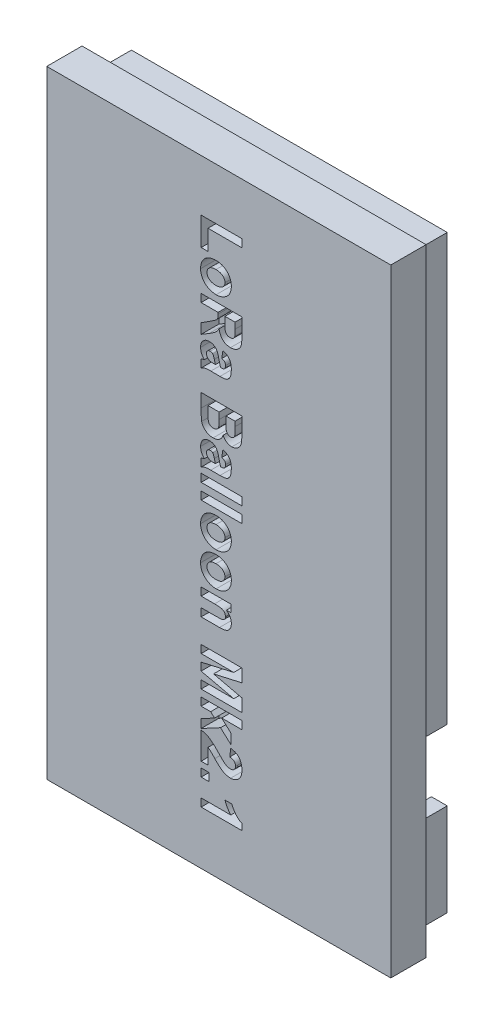
from build123d import *

# Parameters (mm, degrees)
SKETCH1_W          = 39
SKETCH1_H          = 70
BASE_DEPTH         = 4
SKETCH2_W          = 35.8
SKETCH2_H          = 66.8
SKETCH2_W_2        = 32.2
SKETCH2_H_2        = 63.2
MOUNT_DEPTH        = 4
SKETCH3_W          = 0.900579279
SKETCH3_H          = 0.90057928
SKETCH3_W_2        = 4.622973633
SKETCH3_H_2        = 0.900579279
NAME_DEPTH         = 2
SKETCH4_W          = 4
SKETCH4_H          = 8
CUT_EXTRUDE1_DEPTH = 1.8
SKETCH5_W          = 10
SKETCH5_H          = 4
CUT_EXTRUDE2_DEPTH = 1.8


with BuildPart() as part:
    # Sketch1 → Base (new body)
    with BuildSketch(Plane.XY):
        with Locations((19.5, 35)):
            Rectangle(SKETCH1_W, SKETCH1_H)
    extrude(amount=BASE_DEPTH)

    # Sketch2 → Mount (add)
    with BuildSketch(Plane(origin=(0, 0, 0), x_dir=(-1, 0, 0), z_dir=(0, 0, -1))):
        with Locations((-19.5, 35)):
            Rectangle(SKETCH2_W, SKETCH2_H)
        with Locations((-19.5, 35)):
            Rectangle(SKETCH2_W_2, SKETCH2_H_2, mode=Mode.SUBTRACT)
    extrude(amount=MOUNT_DEPTH)

    # Sketch3 → Name (cut)
    # profile 1 of 16: a face of its own
    with BuildSketch(Plane.XY.offset(4)):
        with BuildLine():
            Line((17.5, 6.031366522), (17.5, 6.931945801))
            Line((17.5, 6.931945801), (20.862162642, 6.931945801))
            add(Edge.make_bspline(
                [(20.862162642, 6.931945801), (20.825420678, 6.973453861), (20.752187332, 7.056186897), (20.650809234, 7.187206769), (20.557100635, 7.322777322), (20.471558908, 7.463891787), (20.391697133, 7.608335094), (20.320234004, 7.758471363), (20.256125646, 7.91310561), (20.219928142, 8.019309163), (20.201737837, 8.072679554)],
                knots=[0, 0, 0, 0, 1.001509735, 1.996189151, 2.991510399, 3.978083136, 4.977007007, 5.972841423, 6.981293538, 8, 8, 8, 8], degree=3))
            Line((20.201737837, 8.072679554), (20.982239879, 8.072679554))
            add(Edge.make_bspline(
                [(20.982239879, 8.072679554), (21.005109125, 8.009636198), (21.052173734, 7.879893794), (21.148968325, 7.688624219), (21.269130809, 7.494509439), (21.384880743, 7.332887129), (21.488031291, 7.207004744), (21.569425456, 7.118590303), (21.654643351, 7.038363577), (21.742171402, 6.965389753), (21.83321772, 6.900070199), (21.926439738, 6.842109696), (22.022864157, 6.791460098), (22.089583646, 6.764422764), (22.122973633, 6.750891842)],
                knots=[0, 0, 0, 0, 1.342167567, 2.762163326, 4.283089962, 5.911699164, 6.739232247, 7.541374442, 8.316663201, 9.081638931, 9.82204544, 10.55892081, 11.278807199, 12, 12, 12, 12], degree=3))
            Line((22.122973633, 6.750891842), (22.122973633, 6.031366522))
            Line((22.122973633, 6.031366522), (17.5, 6.031366522))
        make_face()
    # profile 2 of 16: a face of its own
    with BuildSketch(Plane.XY.offset(4)):
        with Locations((17.950289639, 9.423548473)):
            Rectangle(SKETCH3_W, SKETCH3_H)
    # profile 3 of 16: a face of its own
    with BuildSketch(Plane.XY.offset(4)):
        with BuildLine():
            Line((18.280502042, 10.534262917), (17.5, 10.534262917))
            Line((17.5, 10.534262917), (17.5, 13.596232466))
            add(Edge.make_bspline(
                [(17.5, 13.596232466), (17.576949108, 13.585805601), (17.731103203, 13.564917198), (17.956960174, 13.50144426), (18.176976559, 13.413558777), (18.355748105, 13.319061126), (18.500491615, 13.226498924), (18.618013159, 13.142016572), (18.743992969, 13.043312165), (18.877122245, 12.928814113), (19.01967577, 12.800831624), (19.169263399, 12.656658807), (19.328268107, 12.499154665), (19.435248568, 12.387579437), (19.490655448, 12.329792855)],
                knots=[0, 0, 0, 0, 1.156489976, 2.316825642, 3.486320793, 4.683282346, 5.324698959, 6.046521303, 6.840115785, 7.709802379, 8.663715879, 9.695716306, 10.80657488, 12, 12, 12, 12], degree=3))
            add(Edge.make_bspline(
                [(19.490655448, 12.329792855), (19.534031724, 12.284677519), (19.616947467, 12.198437484), (19.736659107, 12.076728308), (19.8457136, 11.968753812), (19.942980669, 11.874007239), (20.029091873, 11.792707575), (20.105351076, 11.726417986), (20.169302387, 11.672159687), (20.210020272, 11.642893937), (20.228004733, 11.629967707)],
                knots=[0, 0, 0, 0, 1.475912402, 2.821274315, 4.025817635, 5.094889091, 6.023583783, 6.817889709, 7.477880126, 8, 8, 8, 8], degree=3))
            add(Edge.make_bspline(
                [(20.228004733, 11.629967707), (20.273808559, 11.600082147), (20.362500689, 11.542213313), (20.505070734, 11.481150256), (20.648064319, 11.442092349), (20.744350233, 11.437235769), (20.791804886, 11.434842196)],
                knots=[0, 0, 0, 0, 1.081757693, 2.094658972, 3.060949906, 4, 4, 4, 4], degree=3))
            add(Edge.make_bspline(
                [(20.791804886, 11.434842196), (20.839190464, 11.436345215), (20.929033186, 11.439194926), (21.054547391, 11.468228017), (21.162042796, 11.516383402), (21.250119658, 11.584209246), (21.318369668, 11.668283776), (21.367895285, 11.764693051), (21.397955403, 11.87335497), (21.400954099, 11.949662912), (21.40251021, 11.989261315)],
                knots=[0, 0, 0, 0, 1.215311032, 2.304221153, 3.285231831, 4.218502273, 5.131618139, 6.043921387, 6.984934089, 8, 8, 8, 8], degree=3))
            add(Edge.make_bspline(
                [(21.40251021, 11.989261315), (21.400764871, 12.032313466), (21.397439101, 12.11434999), (21.365944968, 12.229621644), (21.313665414, 12.329258262), (21.238787013, 12.412038323), (21.143533218, 12.478619319), (21.0275452, 12.527929185), (20.89161993, 12.561367794), (20.793877377, 12.57065489), (20.742085405, 12.57557595)],
                knots=[0, 0, 0, 0, 1.036204622, 1.974503585, 2.854824847, 3.725113167, 4.639232692, 5.635159131, 6.746914543, 8, 8, 8, 8], degree=3))
            Line((20.742085405, 12.57557595), (20.862162642, 13.476155229))
            add(Edge.make_bspline(
                [(20.862162642, 13.476155229), (20.914856848, 13.468924903), (21.017247203, 13.454875622), (21.164229292, 13.419446686), (21.300577042, 13.375788336), (21.426342918, 13.322550059), (21.540554019, 13.258218808), (21.644379225, 13.184749982), (21.738273215, 13.102054447), (21.819847944, 13.008347774), (21.891505772, 12.906292566), (21.953692359, 12.79596872), (22.0057178, 12.677623463), (22.049852168, 12.551778027), (22.081514616, 12.417328436), (22.106536559, 12.275228717), (22.120320981, 12.12493433), (22.122076294, 12.022120737), (22.122973633, 11.969561143)],
                knots=[0, 0, 0, 0, 1.162602182, 2.259057697, 3.301481224, 4.291058719, 5.240278367, 6.162482201, 7.068337645, 7.969664106, 8.872804886, 9.791477257, 10.734443434, 11.696874505, 12.703694303, 13.751554906, 14.850566762, 16, 16, 16, 16], degree=3))
            add(Edge.make_bspline(
                [(22.122973633, 11.969561143), (22.12216436, 11.911958212), (22.120593899, 11.80017506), (22.10070975, 11.638117668), (22.072004647, 11.486359857), (22.028214484, 11.346159334), (21.974171699, 11.215978856), (21.906051478, 11.097706108), (21.827160263, 10.989068519), (21.734640289, 10.894424656), (21.635492304, 10.810293791), (21.531834654, 10.737169245), (21.425852143, 10.673343767), (21.315019184, 10.622432795), (21.20055895, 10.583091186), (21.082762706, 10.554948562), (20.961508115, 10.537346514), (20.879421508, 10.535300855), (20.837771953, 10.534262917)],
                knots=[0, 0, 0, 0, 1.276022515, 2.476225004, 3.613980213, 4.694828494, 5.72599757, 6.731860776, 7.713356894, 8.693775576, 9.657589192, 10.592250898, 11.502803356, 12.395963178, 13.290278707, 14.181284388, 15.077210041, 16, 16, 16, 16], degree=3))
            add(Edge.make_bspline(
                [(20.837771953, 10.534262917), (20.790493163, 10.535236326), (20.696531434, 10.537170874), (20.556651025, 10.556121701), (20.418916098, 10.584936664), (20.282434953, 10.625329041), (20.14772348, 10.679930058), (20.012250121, 10.745399086), (19.877267542, 10.824863433), (19.764667283, 10.900724227), (19.671792871, 10.969915424), (19.596838962, 11.030770989), (19.518336525, 11.10098997), (19.433551797, 11.177527932), (19.344911187, 11.263130781), (19.250792263, 11.356025715), (19.152318029, 11.457407218), (19.085896671, 11.528535938), (19.05162305, 11.565238571)],
                knots=[0, 0, 0, 0, 1.065579015, 2.117728587, 3.177060151, 4.236743671, 5.322224058, 6.451217098, 7.626726301, 8.850986631, 9.510985169, 10.237811417, 11.027173618, 11.885690493, 12.813298488, 13.805522413, 14.867642961, 16, 16, 16, 16], degree=3))
            add(Edge.make_bspline(
                [(19.05162305, 11.565238571), (19.020079063, 11.599046391), (18.960015664, 11.663420389), (18.873550311, 11.754882826), (18.794668334, 11.835818348), (18.72567576, 11.908457691), (18.664320168, 11.970319157), (18.611893835, 12.023282507), (18.567294086, 12.065946194), (18.500825624, 12.127365663), (18.409279651, 12.203320651), (18.322081773, 12.25719707), (18.280502042, 12.282887684)],
                knots=[0, 0, 0, 0, 1.312344043, 2.498854831, 3.572154266, 4.519962786, 5.342095471, 6.044967059, 6.635010651, 7.093519002, 8.614063769, 10, 10, 10, 10], degree=3))
            Line((18.280502042, 12.282887684), (18.280502042, 10.534262917))
        make_face()
    # profile 4 of 16: a face of its own
    with BuildSketch(Plane.XY.offset(4)):
        Polygon((17.5, 16.838317871), (22.122973633, 16.838317871), (22.122973633, 15.937738592), (19.829310781, 15.937738592), (20.862162642, 14.999635176), (20.862162642, 13.86640625), (19.697976303, 14.922710696), (17.5, 13.746329013), (17.5, 14.715389841), (19.026294257, 15.532477916), (18.580695135, 15.937738592), (17.5, 15.937738592), align=None)
    # profile 5 of 16: a face of its own
    with BuildSketch(Plane.XY.offset(4)):
        Polygon((17.5, 22.001639071), (22.122973633, 22.001639071), (22.122973633, 20.538197743), (18.90903133, 19.810229492), (22.122973633, 19.06537538), (22.122973633, 17.618819913), (17.5, 17.618819913), (17.5, 18.519399192), (21.198941768, 18.519399192), (17.5, 19.378701921), (17.5, 20.261457235), (21.198941768, 21.101059792), (17.5, 21.101059792), align=None)
    # profile 6 of 16: a face of its own
    with BuildSketch(Plane.XY.offset(4)):
        with BuildLine():
            Line((17.5, 24.703376909), (17.5, 25.603956188))
            Line((17.5, 25.603956188), (19.218605458, 25.603956188))
            add(Edge.make_bspline(
                [(19.218605458, 25.603956188), (19.259881981, 25.604218431), (19.33868675, 25.604719103), (19.451598313, 25.606227025), (19.553850951, 25.610184029), (19.645484529, 25.614787512), (19.726240729, 25.620031047), (19.796064397, 25.627355164), (19.8548999, 25.636629558), (19.918206403, 25.649836461), (19.986420727, 25.672573643), (20.058026651, 25.710356309), (20.120869879, 25.756588033), (20.171139913, 25.813649771), (20.211805696, 25.876565918), (20.241236399, 25.944645495), (20.258624837, 26.017106197), (20.26071657, 26.066660636), (20.261776456, 26.091769964)],
                knots=[0, 0, 0, 0, 1.518468101, 2.899045743, 4.15374029, 5.282521764, 6.274203078, 7.130400985, 7.864176346, 8.464331223, 9.50833919, 10.496277288, 11.432641907, 12.361201578, 13.276990523, 14.178728215, 15.077158116, 16, 16, 16, 16], degree=3))
            add(Edge.make_bspline(
                [(20.261776456, 26.091769964), (20.260395831, 26.124432779), (20.257666872, 26.188994447), (20.234037383, 26.282658539), (20.197101841, 26.371978971), (20.144264328, 26.45430824), (20.080370598, 26.530343486), (20.001643315, 26.592223164), (19.913268019, 26.643887595), (19.829602888, 26.676153618), (19.752735925, 26.695237438), (19.683087132, 26.709741518), (19.601504403, 26.72009486), (19.508648449, 26.729871123), (19.404062142, 26.735525227), (19.288092488, 26.741809576), (19.160451233, 26.744093369), (19.071635516, 26.744485574), (19.025356154, 26.744689941)],
                knots=[0, 0, 0, 0, 0.987208667, 1.951327175, 2.905781144, 3.900987558, 4.900863378, 5.897104334, 6.91491578, 7.990576578, 8.596595857, 9.311207409, 10.142408639, 11.084155198, 12.136793968, 13.311756484, 14.59923223, 16, 16, 16, 16], degree=3))
            Line((19.025356154, 26.744689941), (17.5, 26.744689941))
            Line((17.5, 26.744689941), (17.5, 27.645269221))
            Line((17.5, 27.645269221), (20.862162642, 27.645269221))
            Line((20.862162642, 27.645269221), (20.862162642, 26.80472856))
            Line((20.862162642, 26.80472856), (20.369658349, 26.80472856))
            add(Edge.make_bspline(
                [(20.369658349, 26.80472856), (20.413616533, 26.770321373), (20.49957413, 26.703040178), (20.611985052, 26.588858325), (20.708270507, 26.468850505), (20.786728659, 26.341680594), (20.847225588, 26.20722185), (20.890517621, 26.066086122), (20.917784325, 25.918022166), (20.920714558, 25.816711582), (20.922201261, 25.765309975)],
                knots=[0, 0, 0, 0, 1.093461536, 2.13819855, 3.132977593, 4.104514142, 5.059389303, 6.015385568, 6.993072912, 8, 8, 8, 8], degree=3))
            add(Edge.make_bspline(
                [(20.922201261, 25.765309975), (20.920317919, 25.706700332), (20.91666388, 25.59298654), (20.885696808, 25.429335393), (20.832707603, 25.280159734), (20.760298213, 25.146629132), (20.672194055, 25.030041421), (20.570901367, 24.931660785), (20.456656392, 24.854076223), (20.352110831, 24.804673832), (20.260861224, 24.775259714), (20.185114665, 24.755547549), (20.101698698, 24.739757931), (20.011142966, 24.727221383), (19.913646699, 24.715475495), (19.808775892, 24.70812277), (19.696745732, 24.704905258), (19.619489692, 24.703895822), (19.579775273, 24.703376909)],
                knots=[0, 0, 0, 0, 1.428465185, 2.77149258, 4.042602701, 5.274402086, 6.460971935, 7.593531473, 8.701853732, 9.81394723, 10.399934156, 11.038034574, 11.721500487, 12.468854998, 13.267186475, 14.115831328, 15.031419898, 16, 16, 16, 16], degree=3))
            Line((19.579775273, 24.703376909), (17.5, 24.703376909))
        make_face()
    # profile 7 of 16: a face of its own
    with BuildSketch(Plane.XY.offset(4)):
        with BuildLine():
            add(Edge.make_bspline(
                [(19.227986492, 31.667856667), (19.268340591, 31.667036399), (19.348241235, 31.665412278), (19.466831788, 31.655463322), (19.582597294, 31.63605464), (19.695714536, 31.61096501), (19.806416527, 31.579441893), (19.913363069, 31.538151235), (20.018572563, 31.492044265), (20.119538873, 31.437034064), (20.216642118, 31.37772074), (20.307982668, 31.31296281), (20.392270804, 31.242988622), (20.471764649, 31.17048616), (20.542963196, 31.091302442), (20.610173753, 31.009624992), (20.668761487, 30.921545212), (20.722741328, 30.830764248), (20.769340893, 30.735441575), (20.810963092, 30.637695358), (20.84421655, 30.535984358), (20.874003462, 30.432726526), (20.895076066, 30.325606876), (20.911226693, 30.216077493), (20.920807626, 30.103272259), (20.921733394, 30.027131659), (20.922201261, 29.988651553)],
                knots=[0, 0, 0, 0, 1.087797627, 2.153826546, 3.204146119, 4.249074796, 5.276002369, 6.302929943, 7.33671768, 8.369955531, 9.399197913, 10.402506754, 11.384561342, 12.350717656, 13.299250364, 14.252266119, 15.199037181, 16.147307724, 17.097187567, 18.056740571, 19.008264324, 19.97962709, 20.951574749, 21.948063114, 22.962987564, 24, 24, 24, 24], degree=3))
            add(Edge.make_bspline(
                [(20.922201261, 29.988651553), (20.920492435, 29.924793493), (20.917163302, 29.800385279), (20.89380331, 29.618918473), (20.853287611, 29.448294563), (20.797267351, 29.287458199), (20.72326136, 29.137817172), (20.634810544, 28.997501786), (20.529143938, 28.868450261), (20.40795289, 28.752300781), (20.277240101, 28.647523356), (20.139130934, 28.556579151), (19.996080966, 28.47910388), (19.847473094, 28.415937377), (19.693540221, 28.365560189), (19.533372162, 28.331856616), (19.368435672, 28.308776132), (19.256523789, 28.306730224), (19.199843389, 28.305694025)],
                knots=[0, 0, 0, 0, 1.136040707, 2.213233445, 3.248238065, 4.25119704, 5.236487175, 6.211911138, 7.196384178, 8.195725979, 9.1931767, 10.173001403, 11.133846892, 12.083513917, 13.042376269, 14.010298635, 14.992269034, 16, 16, 16, 16], degree=3))
            add(Edge.make_bspline(
                [(19.199843389, 28.305694025), (19.157599655, 28.306375339), (19.0738988, 28.307725281), (18.949923499, 28.319708358), (18.828866965, 28.336918185), (18.710806659, 28.362715812), (18.595913097, 28.394995558), (18.484212787, 28.436018323), (18.375843769, 28.483701954), (18.270645012, 28.537857586), (18.171228883, 28.598868058), (18.076479739, 28.663312491), (17.989613644, 28.733981019), (17.908343846, 28.808413365), (17.833120613, 28.887136475), (17.764474284, 28.970880003), (17.702322369, 29.059272896), (17.647348245, 29.152054033), (17.598380596, 29.247901658), (17.556075444, 29.34662638), (17.52061437, 29.447625363), (17.49154767, 29.55076545), (17.4673821, 29.655801901), (17.452433072, 29.763820298), (17.441007522, 29.873647075), (17.440311587, 29.947656406), (17.439961381, 29.984899139)],
                knots=[0, 0, 0, 0, 1.117558833, 2.214307803, 3.293244786, 4.351421184, 5.409597582, 6.448807362, 7.497331125, 8.540978692, 9.576922014, 10.582241184, 11.570837346, 12.537122916, 13.496974449, 14.449450387, 15.399839374, 16.353464778, 17.300823134, 18.246083241, 19.193441597, 20.131138339, 21.080698472, 22.042616426, 23.015011865, 24, 24, 24, 24], degree=3))
            add(Edge.make_bspline(
                [(17.439961381, 29.984899139), (17.441434818, 30.04406421), (17.444329398, 30.160294537), (17.466190044, 30.33088657), (17.502637169, 30.493596014), (17.553836141, 30.648679353), (17.618260134, 30.796499008), (17.698440035, 30.936217507), (17.79447105, 31.067058897), (17.902499007, 31.190733435), (18.024251963, 31.303867806), (18.159878703, 31.401567068), (18.308067385, 31.483794972), (18.468125433, 31.551399101), (18.640780217, 31.603847691), (18.825794291, 31.641044136), (19.022910429, 31.66380433), (19.158504181, 31.666483685), (19.227986492, 31.667856667)],
                knots=[0, 0, 0, 0, 1.024594995, 2.012826322, 2.973358778, 3.908543225, 4.837401023, 5.761810751, 6.69243552, 7.644223827, 8.602462928, 9.564551743, 10.532007457, 11.531954493, 12.568505162, 13.651979317, 14.796803673, 16, 16, 16, 16], degree=3))
        make_face()
        with BuildLine():
            add(Edge.make_bspline(
                [(19.181081321, 30.767277388), (19.140418132, 30.7664685), (19.061457429, 30.764897782), (18.946509384, 30.755317355), (18.839622498, 30.735604285), (18.739486697, 30.712662461), (18.647961982, 30.678719777), (18.563118232, 30.640144076), (18.486368037, 30.592693862), (18.418159022, 30.538377324), (18.358227437, 30.478913691), (18.305063926, 30.416760149), (18.260023454, 30.351559232), (18.223835025, 30.282773737), (18.195763008, 30.211300883), (18.174765469, 30.136603171), (18.162389452, 30.058800558), (18.161082475, 30.005893388), (18.160424805, 29.979270519)],
                knots=[0, 0, 0, 0, 1.347985487, 2.617548842, 3.817114289, 4.948286482, 6.017057593, 7.046407217, 8.032969353, 8.999289909, 9.930051738, 10.827140183, 11.706817169, 12.550594062, 13.397420762, 14.247349517, 15.118066881, 16, 16, 16, 16], degree=3))
            add(Edge.make_bspline(
                [(18.160424805, 29.979270519), (18.161082172, 29.95327184), (18.162388524, 29.90160605), (18.174768649, 29.825667547), (18.195758212, 29.752830162), (18.224167513, 29.682614172), (18.260561859, 29.61498155), (18.306359128, 29.551083491), (18.359147439, 29.489568475), (18.42010437, 29.431777283), (18.488357165, 29.377647138), (18.565874129, 29.331881148), (18.650982245, 29.2934674), (18.743354127, 29.261692013), (18.843361939, 29.236148079), (18.951359004, 29.218739084), (19.067059726, 29.208514906), (19.146662829, 29.207035174), (19.187648045, 29.206273304)],
                knots=[0, 0, 0, 0, 0.86498205, 1.718932724, 2.552529207, 3.383717481, 4.236080589, 5.102502034, 5.995588818, 6.930639414, 7.894730959, 8.889086482, 9.918564038, 10.998334367, 12.1369617, 13.350269694, 14.635734454, 16, 16, 16, 16], degree=3))
            add(Edge.make_bspline(
                [(19.187648045, 29.206273304), (19.227688932, 29.207071515), (19.305407142, 29.208620818), (19.418448526, 29.21833585), (19.523973479, 29.237633658), (19.622320571, 29.262397561), (19.713524667, 29.294467861), (19.797316766, 29.333759882), (19.873991238, 29.380754838), (19.942107737, 29.435517195), (20.003044034, 29.494278407), (20.055828048, 29.556726541), (20.101619145, 29.621572383), (20.138009283, 29.690136473), (20.166408615, 29.761288764), (20.187393837, 29.83506114), (20.199774112, 29.911930299), (20.201080471, 29.964216902), (20.201737837, 29.99052776)],
                knots=[0, 0, 0, 0, 1.337232047, 2.595528913, 3.783536199, 4.915617704, 5.97906533, 7.006690339, 8.000659516, 8.974235141, 9.919454987, 10.823278711, 11.700968276, 12.565199868, 13.408680491, 14.254935835, 15.121875735, 16, 16, 16, 16], degree=3))
            add(Edge.make_bspline(
                [(20.201737837, 29.99052776), (20.201125638, 30.01684595), (20.199923414, 30.068529121), (20.187117275, 30.14469067), (20.1666105, 30.217653188), (20.137959369, 30.288106282), (20.10165055, 30.355793068), (20.055496899, 30.419705203), (20.003354012, 30.482079465), (19.942036507, 30.539894934), (19.873587127, 30.593986498), (19.796542842, 30.640468461), (19.712370979, 30.68027929), (19.620397249, 30.711967226), (19.521262796, 30.737162293), (19.414268616, 30.754931366), (19.300102491, 30.764983319), (19.221439565, 30.766499505), (19.181081321, 30.767277388)],
                knots=[0, 0, 0, 0, 0.8777483, 1.723705717, 2.56959874, 3.403036217, 4.257705828, 5.126471818, 6.029908573, 6.967489424, 7.934189811, 8.936630112, 9.963815147, 11.036651848, 12.178360317, 13.374360467, 14.652907978, 16, 16, 16, 16], degree=3))
        make_face(mode=Mode.SUBTRACT)
    # profile 8 of 16: a face of its own
    with BuildSketch(Plane.XY.offset(4)):
        with BuildLine():
            add(Edge.make_bspline(
                [(19.227986492, 35.510328258), (19.268340591, 35.50950799), (19.348241235, 35.507883869), (19.466831788, 35.497934913), (19.582597294, 35.478526231), (19.695714536, 35.453436601), (19.806416527, 35.421913484), (19.913363069, 35.380622826), (20.018572563, 35.334515856), (20.119538873, 35.279505655), (20.216642118, 35.22019233), (20.307982668, 35.155434401), (20.392270804, 35.085460213), (20.471764649, 35.012957751), (20.542963196, 34.933774033), (20.610173753, 34.852096583), (20.668761487, 34.764016803), (20.722741328, 34.673235839), (20.769340893, 34.577913166), (20.810963092, 34.480166949), (20.84421655, 34.378455949), (20.874003462, 34.275198117), (20.895076066, 34.168078467), (20.911226693, 34.058549084), (20.920807626, 33.945743849), (20.921733394, 33.86960325), (20.922201261, 33.831123144)],
                knots=[0, 0, 0, 0, 1.087797627, 2.153826546, 3.204146119, 4.249074796, 5.276002369, 6.302929943, 7.33671768, 8.369955531, 9.399197913, 10.402506754, 11.384561342, 12.350717656, 13.299250364, 14.252266119, 15.199037181, 16.147307724, 17.097187567, 18.056740571, 19.008264324, 19.97962709, 20.951574749, 21.948063114, 22.962987564, 24, 24, 24, 24], degree=3))
            add(Edge.make_bspline(
                [(20.922201261, 33.831123144), (20.920492435, 33.767265084), (20.917163302, 33.64285687), (20.89380331, 33.461390064), (20.853287611, 33.290766154), (20.797267351, 33.12992979), (20.72326136, 32.980288763), (20.634810544, 32.839973377), (20.529143938, 32.710921852), (20.40795289, 32.594772372), (20.277240101, 32.489994947), (20.139130934, 32.399050742), (19.996080966, 32.321575471), (19.847473094, 32.258408968), (19.693540221, 32.20803178), (19.533372162, 32.174328206), (19.368435672, 32.151247723), (19.256523789, 32.149201815), (19.199843389, 32.148165616)],
                knots=[0, 0, 0, 0, 1.136040707, 2.213233445, 3.248238065, 4.25119704, 5.236487175, 6.211911138, 7.196384178, 8.195725979, 9.1931767, 10.173001403, 11.133846892, 12.083513917, 13.042376269, 14.010298635, 14.992269034, 16, 16, 16, 16], degree=3))
            add(Edge.make_bspline(
                [(19.199843389, 32.148165616), (19.157599655, 32.14884693), (19.0738988, 32.150196872), (18.949923499, 32.162179949), (18.828866965, 32.179389776), (18.710806659, 32.205187403), (18.595913097, 32.237467149), (18.484212787, 32.278489913), (18.375843769, 32.326173545), (18.270645012, 32.380329177), (18.171228883, 32.441339649), (18.076479739, 32.505784082), (17.989613644, 32.57645261), (17.908343846, 32.650884955), (17.833120613, 32.729608066), (17.764474284, 32.813351594), (17.702322369, 32.901744487), (17.647348245, 32.994525624), (17.598380596, 33.090373249), (17.556075444, 33.189097971), (17.52061437, 33.290096954), (17.49154767, 33.393237041), (17.4673821, 33.498273492), (17.452433072, 33.606291889), (17.441007522, 33.716118666), (17.440311587, 33.790127997), (17.439961381, 33.82737073)],
                knots=[0, 0, 0, 0, 1.117558833, 2.214307803, 3.293244786, 4.351421184, 5.409597582, 6.448807362, 7.497331125, 8.540978692, 9.576922014, 10.582241184, 11.570837346, 12.537122916, 13.496974449, 14.449450387, 15.399839374, 16.353464778, 17.300823134, 18.246083241, 19.193441597, 20.131138339, 21.080698472, 22.042616426, 23.015011865, 24, 24, 24, 24], degree=3))
            add(Edge.make_bspline(
                [(17.439961381, 33.82737073), (17.441434818, 33.886535801), (17.444329398, 34.002766128), (17.466190044, 34.173358161), (17.502637169, 34.336067605), (17.553836141, 34.491150944), (17.618260134, 34.638970598), (17.698440035, 34.778689098), (17.79447105, 34.909530488), (17.902499007, 35.033205026), (18.024251963, 35.146339397), (18.159878703, 35.244038659), (18.308067385, 35.326266563), (18.468125433, 35.393870691), (18.640780217, 35.446319282), (18.825794291, 35.483515727), (19.022910429, 35.506275921), (19.158504181, 35.508955276), (19.227986492, 35.510328258)],
                knots=[0, 0, 0, 0, 1.024594995, 2.012826322, 2.973358778, 3.908543225, 4.837401023, 5.761810751, 6.69243552, 7.644223827, 8.602462928, 9.564551743, 10.532007457, 11.531954493, 12.568505162, 13.651979317, 14.796803673, 16, 16, 16, 16], degree=3))
        make_face()
        with BuildLine():
            add(Edge.make_bspline(
                [(19.181081321, 34.609748979), (19.140418132, 34.608940091), (19.061457429, 34.607369372), (18.946509384, 34.597788946), (18.839622498, 34.578075876), (18.739486697, 34.555134052), (18.647961982, 34.521191368), (18.563118232, 34.482615667), (18.486368037, 34.435165452), (18.418159022, 34.380848915), (18.358227437, 34.321385282), (18.305063926, 34.25923174), (18.260023454, 34.194030823), (18.223835025, 34.125245328), (18.195763008, 34.053772474), (18.174765469, 33.979074761), (18.162389452, 33.901272149), (18.161082475, 33.848364979), (18.160424805, 33.82174211)],
                knots=[0, 0, 0, 0, 1.347985487, 2.617548842, 3.817114289, 4.948286482, 6.017057593, 7.046407217, 8.032969353, 8.999289909, 9.930051738, 10.827140183, 11.706817169, 12.550594062, 13.397420762, 14.247349517, 15.118066881, 16, 16, 16, 16], degree=3))
            add(Edge.make_bspline(
                [(18.160424805, 33.82174211), (18.161082172, 33.795743431), (18.162388524, 33.744077641), (18.174768649, 33.668139138), (18.195758212, 33.595301753), (18.224167513, 33.525085763), (18.260561859, 33.457453141), (18.306359128, 33.393555082), (18.359147439, 33.332040066), (18.42010437, 33.274248873), (18.488357165, 33.220118729), (18.565874129, 33.174352739), (18.650982245, 33.135938991), (18.743354127, 33.104163604), (18.843361939, 33.07861967), (18.951359004, 33.061210674), (19.067059726, 33.050986497), (19.146662829, 33.049506765), (19.187648045, 33.048744895)],
                knots=[0, 0, 0, 0, 0.86498205, 1.718932724, 2.552529207, 3.383717481, 4.236080589, 5.102502034, 5.995588818, 6.930639414, 7.894730959, 8.889086482, 9.918564038, 10.998334367, 12.1369617, 13.350269694, 14.635734454, 16, 16, 16, 16], degree=3))
            add(Edge.make_bspline(
                [(19.187648045, 33.048744895), (19.227688932, 33.049543106), (19.305407142, 33.051092409), (19.418448526, 33.060807441), (19.523973479, 33.080105249), (19.622320571, 33.104869152), (19.713524667, 33.136939452), (19.797316766, 33.176231473), (19.873991238, 33.223226429), (19.942107737, 33.277988786), (20.003044034, 33.336749998), (20.055828048, 33.399198132), (20.101619145, 33.464043973), (20.138009283, 33.532608064), (20.166408615, 33.603760355), (20.187393837, 33.677532731), (20.199774112, 33.75440189), (20.201080471, 33.806688493), (20.201737837, 33.832999351)],
                knots=[0, 0, 0, 0, 1.337232047, 2.595528913, 3.783536199, 4.915617704, 5.97906533, 7.006690339, 8.000659516, 8.974235141, 9.919454987, 10.823278711, 11.700968276, 12.565199868, 13.408680491, 14.254935835, 15.121875735, 16, 16, 16, 16], degree=3))
            add(Edge.make_bspline(
                [(20.201737837, 33.832999351), (20.201125638, 33.859317541), (20.199923414, 33.911000712), (20.187117275, 33.987162261), (20.1666105, 34.060124779), (20.137959369, 34.130577873), (20.10165055, 34.198264659), (20.055496899, 34.262176794), (20.003354012, 34.324551056), (19.942036507, 34.382366525), (19.873587127, 34.436458089), (19.796542842, 34.482940052), (19.712370979, 34.522750881), (19.620397249, 34.554438817), (19.521262796, 34.579633884), (19.414268616, 34.597402957), (19.300102491, 34.60745491), (19.221439565, 34.608971096), (19.181081321, 34.609748979)],
                knots=[0, 0, 0, 0, 0.8777483, 1.723705717, 2.56959874, 3.403036217, 4.257705828, 5.126471818, 6.029908573, 6.967489424, 7.934189811, 8.936630112, 9.963815147, 11.036651848, 12.178360317, 13.374360467, 14.652907978, 16, 16, 16, 16], degree=3))
        make_face(mode=Mode.SUBTRACT)
    # profile 9 of 16: a face of its own
    with BuildSketch(Plane.XY.offset(4)):
        with Locations((19.811486817, 36.621042703)):
            Rectangle(SKETCH3_W_2, SKETCH3_H_2)
    # profile 10 of 16: a face of its own
    with BuildSketch(Plane.XY.offset(4)):
        with Locations((19.811486817, 38.362162642)):
            Rectangle(SKETCH3_W_2, SKETCH3_H)
    # profile 11 of 16: a face of its own
    with BuildSketch(Plane.XY.offset(4)):
        with BuildLine():
            Line((19.841506126, 41.514190119), (19.961583363, 42.354730779))
            add(Edge.make_bspline(
                [(19.961583363, 42.354730779), (20.003056427, 42.342822179), (20.08373433, 42.319656279), (20.198162111, 42.275938335), (20.30438426, 42.228511596), (20.401073835, 42.173704259), (20.489620864, 42.114291351), (20.568113139, 42.04778228), (20.637964286, 41.976247779), (20.699606916, 41.898815948), (20.752828321, 41.813756771), (20.798705368, 41.720744549), (20.837141958, 41.618910851), (20.867740873, 41.508588649), (20.892075182, 41.389790884), (20.909807303, 41.262288114), (20.919932697, 41.125979697), (20.921430674, 41.032334458), (20.922201261, 40.984161689)],
                knots=[0, 0, 0, 0, 1.125515524, 2.189474865, 3.193709533, 4.158305409, 5.086274303, 5.972285183, 6.837881566, 7.691743787, 8.549806887, 9.451203831, 10.393874208, 11.385866739, 12.435713252, 13.556277782, 14.742906037, 16, 16, 16, 16], degree=3))
            add(Edge.make_bspline(
                [(20.922201261, 40.984161689), (20.921986052, 40.941308612), (20.921567926, 40.858049768), (20.914195236, 40.737032314), (20.905701633, 40.623632526), (20.891648419, 40.518072692), (20.872802431, 40.420437543), (20.850656262, 40.330428478), (20.824366297, 40.248284068), (20.785361186, 40.151390147), (20.72686919, 40.044591849), (20.645227411, 39.932595052), (20.550150903, 39.841460018), (20.460504459, 39.780205056), (20.378336951, 39.742361729), (20.305144759, 39.718802341), (20.220833774, 39.698070589), (20.12519058, 39.681662166), (20.01811083, 39.668705222), (19.899799318, 39.659583899), (19.770265296, 39.653953559), (19.680158536, 39.653321832), (19.633247167, 39.652992942)],
                knots=[0, 0, 0, 0, 1.172645795, 2.278322549, 3.317437237, 4.284552983, 5.190951134, 6.037858116, 6.820064311, 7.549551753, 8.893788561, 10.141635195, 11.328036199, 12.481663495, 13.094362176, 13.79803918, 14.582676335, 15.469136844, 16.45214095, 17.533908717, 18.716103928, 20, 20, 20, 20], degree=3))
            Line((19.633247167, 39.652992942), (18.599457203, 39.660497769))
            add(Edge.make_bspline(
                [(18.599457203, 39.660497769), (18.564435728, 39.660205788), (18.496576972, 39.659640035), (18.398330909, 39.658483265), (18.307040045, 39.653276812), (18.222621106, 39.647594933), (18.144878475, 39.641908735), (18.074326469, 39.631817777), (18.010639761, 39.622171991), (17.934153527, 39.605482237), (17.841504636, 39.577679009), (17.729923806, 39.534274983), (17.614669352, 39.479704593), (17.539082625, 39.435628373), (17.5, 39.412838468)],
                knots=[0, 0, 0, 0, 1.100960395, 2.13325684, 3.08799504, 3.974623839, 4.793377983, 5.537123068, 6.214225653, 6.817686965, 7.996461938, 9.250537039, 10.578371695, 12, 12, 12, 12], degree=3))
            Line((17.5, 39.412838468), (17.5, 40.313417747))
            Line((17.5, 40.313417747), (17.867736539, 40.423175846))
            add(Edge.make_bspline(
                [(17.867736539, 40.423175846), (17.83226304, 40.45939334), (17.763238807, 40.529865237), (17.674416477, 40.644972922), (17.599695505, 40.763146591), (17.540260444, 40.886002381), (17.494849843, 41.012800628), (17.463178517, 41.143313177), (17.443827041, 41.277834702), (17.441261018, 41.368719791), (17.439961381, 41.414751157)],
                knots=[0, 0, 0, 0, 1.094238684, 2.129166538, 3.133671034, 4.10942336, 5.070833053, 6.037377746, 7.005973528, 8, 8, 8, 8], degree=3))
            add(Edge.make_bspline(
                [(17.439961381, 41.414751157), (17.441007341, 41.452615094), (17.443061457, 41.526974436), (17.454903777, 41.636008247), (17.476538098, 41.739623758), (17.507054288, 41.837634891), (17.543951561, 41.931232993), (17.591661801, 42.018833627), (17.646964549, 42.10164001), (17.71053094, 42.178636515), (17.781922723, 42.247322475), (17.857738316, 42.309714251), (17.941277911, 42.359576677), (18.028844016, 42.40317387), (18.123266364, 42.434066264), (18.222597532, 42.458105194), (18.327631273, 42.472178413), (18.399600412, 42.473921114), (18.436227209, 42.474808017)],
                knots=[0, 0, 0, 0, 1.111028414, 2.181900458, 3.212888925, 4.21115239, 5.190734394, 6.159429897, 7.131421471, 8.108723925, 9.081883785, 10.034678926, 10.981892532, 11.929727932, 12.898727489, 13.888948844, 14.925636122, 16, 16, 16, 16], degree=3))
            add(Edge.make_bspline(
                [(18.436227209, 42.474808017), (18.482593242, 42.473372815), (18.572724924, 42.470582904), (18.703283791, 42.448793498), (18.824622959, 42.412391226), (18.936022841, 42.360139981), (19.037479655, 42.295376718), (19.129142785, 42.218524625), (19.208842276, 42.128547659), (19.267148448, 42.044124803), (19.309753926, 41.96862461), (19.338835724, 41.902402774), (19.369441505, 41.829644903), (19.396985309, 41.748124366), (19.425368881, 41.659150164), (19.452494502, 41.56188663), (19.4774731, 41.456230244), (19.493569489, 41.383190178), (19.501912689, 41.345331504)],
                knots=[0, 0, 0, 0, 1.294162278, 2.515743014, 3.684113667, 4.820865117, 5.939906549, 7.036651616, 8.149715676, 9.285662014, 9.895437351, 10.567486448, 11.303637924, 12.098932185, 12.968810962, 13.91153998, 14.917493754, 16, 16, 16, 16], degree=3))
            add(Edge.make_bspline(
                [(19.501912689, 41.345331504), (19.511407002, 41.29963326), (19.529650374, 41.211823847), (19.559131352, 41.085951379), (19.587017816, 40.970804952), (19.61413993, 40.866238728), (19.640930358, 40.772559678), (19.668501435, 40.689876759), (19.694085633, 40.617635872), (19.712787099, 40.57381943), (19.721428888, 40.553572221)],
                knots=[0, 0, 0, 0, 1.361164628, 2.615484881, 3.770095419, 4.816364149, 5.765912261, 6.610903979, 7.358110453, 8, 8, 8, 8], degree=3))
            add(Edge.make_bspline(
                [(19.721428888, 40.553572221), (19.76207844, 40.554231496), (19.835936364, 40.55542936), (19.93546068, 40.560763475), (20.012171286, 40.572303879), (20.070146149, 40.58844442), (20.113156329, 40.61503175), (20.150196809, 40.646884119), (20.18179134, 40.688294767), (20.210776693, 40.737003838), (20.234039299, 40.795757876), (20.250744994, 40.864838443), (20.259418855, 40.94454444), (20.260957962, 41.001028678), (20.261776456, 41.03106686)],
                knots=[0, 0, 0, 0, 1.704637254, 3.09722893, 4.172654963, 4.956246112, 5.596985007, 6.275246559, 6.99385986, 7.769515704, 8.645866914, 9.631493719, 10.740434052, 12, 12, 12, 12], degree=3))
            add(Edge.make_bspline(
                [(20.261776456, 41.03106686), (20.260884607, 41.061819135), (20.25919465, 41.120091345), (20.241526382, 41.202176529), (20.215410217, 41.274928832), (20.174002857, 41.337526849), (20.117664666, 41.392371274), (20.042764104, 41.439724199), (19.949087652, 41.481595463), (19.879011929, 41.502826748), (19.841506126, 41.514190119)],
                knots=[0, 0, 0, 0, 1.045871977, 1.981813381, 2.848317391, 3.663751395, 4.514929533, 5.507645304, 6.666046366, 8, 8, 8, 8], degree=3))
        make_face()
        with BuildLine():
            add(Edge.make_bspline(
                [(19.121042702, 40.553572221), (19.111478433, 40.581029413), (19.090198568, 40.642119846), (19.059474829, 40.744742381), (19.027018533, 40.867855942), (19.005193715, 40.956919288), (18.993460638, 41.004799964)],
                knots=[0, 0, 0, 0, 0.743632693, 1.654533494, 2.73907137, 4, 4, 4, 4], degree=3))
            add(Edge.make_bspline(
                [(18.993460638, 41.004799964), (18.98653897, 41.033017956), (18.97332241, 41.08689873), (18.950053418, 41.163232813), (18.928514853, 41.232519981), (18.904326783, 41.293793407), (18.881777826, 41.348222317), (18.857166421, 41.394601166), (18.832210074, 41.433424727), (18.813567384, 41.455259472), (18.804901851, 41.465408741)],
                knots=[0, 0, 0, 0, 1.388607462, 2.65147299, 3.814389992, 4.855436495, 5.799565367, 6.62877246, 7.362623276, 8, 8, 8, 8], degree=3))
            add(Edge.make_bspline(
                [(18.804901851, 41.465408741), (18.787150786, 41.482293284), (18.752087496, 41.515644953), (18.686643373, 41.549529351), (18.614581201, 41.571002361), (18.563658271, 41.573135007), (18.537542378, 41.574228738)],
                knots=[0, 0, 0, 0, 0.985740837, 1.947112291, 2.947173789, 4, 4, 4, 4], degree=3))
            add(Edge.make_bspline(
                [(18.537542378, 41.574228738), (18.50766342, 41.572939924), (18.449801672, 41.570444088), (18.366786442, 41.546484186), (18.290760217, 41.50914416), (18.224593068, 41.455951695), (18.168585191, 41.393231307), (18.129814521, 41.31928554), (18.103890852, 41.238862588), (18.101569181, 41.18199624), (18.100386186, 41.153020304)],
                knots=[0, 0, 0, 0, 1.056198986, 2.045369905, 3.036276429, 4.038084886, 5.035473036, 5.992159802, 6.976916006, 8, 8, 8, 8], degree=3))
            add(Edge.make_bspline(
                [(18.100386186, 41.153020304), (18.101736527, 41.126025569), (18.104453435, 41.071711719), (18.124157539, 40.990656531), (18.156784545, 40.910533962), (18.200051148, 40.832286446), (18.252073425, 40.760421569), (18.311090427, 40.699433639), (18.374225547, 40.649895191), (18.432190619, 40.617965881), (18.484079963, 40.599086358), (18.530121172, 40.587625835), (18.5827991, 40.575734161), (18.642798398, 40.568047983), (18.709733915, 40.561359924), (18.78390109, 40.556870895), (18.865230729, 40.554055933), (18.921849407, 40.553737535), (18.951245984, 40.553572221)],
                knots=[0, 0, 0, 0, 1.093500888, 2.200141778, 3.360346716, 4.591280596, 5.815607582, 6.94487563, 8.019710678, 9.057444999, 9.610729159, 10.253199895, 10.979011171, 11.798077413, 12.702238226, 13.705425431, 14.808650418, 16, 16, 16, 16], degree=3))
            Line((18.951245984, 40.553572221), (19.121042702, 40.553572221))
        make_face(mode=Mode.SUBTRACT)
    # profile 12 of 16: a face of its own
    with BuildSketch(Plane.XY.offset(4)):
        with BuildLine():
            Line((22.122973633, 46.737549938), (22.122973633, 44.910124484))
            add(Edge.make_bspline(
                [(22.122973633, 44.910124484), (22.122521051, 44.850084862), (22.121651102, 44.734677139), (22.117632998, 44.568221255), (22.108005759, 44.415905539), (22.095757541, 44.277353061), (22.081840746, 44.152540778), (22.061533426, 44.041599191), (22.040180572, 43.944097754), (22.0049456, 43.833595711), (21.948462842, 43.709246881), (21.859088002, 43.573885608), (21.748544411, 43.450302277), (21.640427701, 43.359753677), (21.545807025, 43.29495681), (21.471963858, 43.251349674), (21.394724771, 43.215890036), (21.315529677, 43.187009152), (21.2346417, 43.162652812), (21.150572045, 43.147614693), (21.064475175, 43.136283422), (21.006044505, 43.135584759), (20.976611259, 43.135232821)],
                knots=[0, 0, 0, 0, 1.498327689, 2.88007457, 4.154414764, 5.305986542, 6.351317343, 7.286582663, 8.11946184, 8.840080679, 10.177555878, 11.512935148, 12.872513647, 14.301275782, 15.019863751, 15.733221227, 16.438466007, 17.137161526, 17.836031326, 18.543086972, 19.26611006, 20, 20, 20, 20], degree=3))
            add(Edge.make_bspline(
                [(20.976611259, 43.135232821), (20.922946761, 43.137303044), (20.817024149, 43.141389234), (20.662821857, 43.176710702), (20.51596526, 43.232138074), (20.380113254, 43.311328688), (20.256588311, 43.407542998), (20.148778926, 43.518348036), (20.056681459, 43.641777128), (20.011500867, 43.733566768), (19.988788362, 43.779709868)],
                knots=[0, 0, 0, 0, 1.031817477, 2.036594177, 3.029254201, 4.043130586, 5.050931669, 6.034203586, 7.01178454, 8, 8, 8, 8], degree=3))
            add(Edge.make_bspline(
                [(19.988788362, 43.779709868), (19.978291223, 43.748276354), (19.957542489, 43.686144606), (19.919057509, 43.596987521), (19.874445181, 43.513373813), (19.826159834, 43.433822513), (19.770442173, 43.360917896), (19.709973461, 43.293161392), (19.645321829, 43.229379638), (19.573797837, 43.173095387), (19.499063042, 43.120637644), (19.418797393, 43.076896374), (19.335071516, 43.039243904), (19.247401209, 43.00781132), (19.155229507, 42.984808535), (19.059306459, 42.967942303), (18.959608937, 42.957391697), (18.891858621, 42.95588334), (18.857435643, 42.955116966)],
                knots=[0, 0, 0, 0, 1.053917501, 2.08318216, 3.084375989, 4.067115349, 5.039987852, 5.998256831, 6.954975631, 7.924383767, 8.890110205, 9.856297623, 10.826929889, 11.808561028, 12.814635272, 13.844956918, 14.905053061, 16, 16, 16, 16], degree=3))
            add(Edge.make_bspline(
                [(18.857435643, 42.955116966), (18.815500063, 42.956062077), (18.733295748, 42.957914735), (18.612472135, 42.971178049), (18.496620731, 42.993557639), (18.385911071, 43.025581587), (18.279951486, 43.065972101), (18.179119697, 43.115922872), (18.083315073, 43.175373566), (17.992730779, 43.242648072), (17.90919217, 43.316006825), (17.833589227, 43.393712653), (17.765489185, 43.473928008), (17.707581308, 43.559131829), (17.656528591, 43.646316505), (17.61374927, 43.736794735), (17.581005615, 43.831050671), (17.565164633, 43.895583163), (17.557224308, 43.927930208)],
                knots=[0, 0, 0, 0, 1.145607172, 2.24567906, 3.316329682, 4.365460088, 5.390414304, 6.410550385, 7.434792233, 8.46684308, 9.489944109, 10.468671886, 11.426900475, 12.36059261, 13.279351643, 14.185149476, 15.09030244, 16, 16, 16, 16], degree=3))
            add(Edge.make_bspline(
                [(17.557224308, 43.927930208), (17.552629506, 43.954476266), (17.542179673, 44.014849236), (17.530238938, 44.117507113), (17.521967062, 44.242764847), (17.512784829, 44.390627107), (17.508239794, 44.561140115), (17.503113461, 44.754373132), (17.500511164, 44.970156543), (17.500175925, 45.12151011), (17.5, 45.200936543)],
                knots=[0, 0, 0, 0, 0.506837559, 1.152686718, 1.943271314, 2.868501158, 3.939884368, 5.152247396, 6.505573166, 8, 8, 8, 8], degree=3))
            Line((17.5, 45.200936543), (17.5, 46.737549938))
            Line((17.5, 46.737549938), (22.122973633, 46.737549938))
        make_face()
        with BuildLine():
            Line((21.342471591, 45.836970659), (20.321815075, 45.836970659))
            Line((20.321815075, 45.836970659), (20.321815075, 45.223451025))
            add(Edge.make_bspline(
                [(20.321815075, 45.223451025), (20.321708304, 45.179672293), (20.321505436, 45.096491461), (20.322860414, 44.97829506), (20.323271951, 44.873214079), (20.325612076, 44.7812947), (20.326868369, 44.702771579), (20.330184865, 44.637450258), (20.332255296, 44.585143819), (20.33545221, 44.554574189), (20.336824729, 44.541449842)],
                knots=[0, 0, 0, 0, 1.539755574, 2.925579234, 4.157432792, 5.235486124, 6.159601295, 6.919197766, 7.535983151, 8, 8, 8, 8], degree=3))
            add(Edge.make_bspline(
                [(20.336824729, 44.541449842), (20.342990913, 44.503699738), (20.354742688, 44.431753986), (20.388025395, 44.330904457), (20.433788831, 44.243241231), (20.491801151, 44.16799627), (20.562445267, 44.108032512), (20.646094328, 44.066032847), (20.740542137, 44.040045927), (20.807575483, 44.037261325), (20.84246247, 44.0358121)],
                knots=[0, 0, 0, 0, 1.156043088, 2.203236031, 3.197816213, 4.134692963, 5.061434266, 5.975433912, 6.946330216, 8, 8, 8, 8], degree=3))
            add(Edge.make_bspline(
                [(20.84246247, 44.0358121), (20.873876263, 44.036823866), (20.934019538, 44.038760942), (21.019351721, 44.060444709), (21.096016804, 44.093937475), (21.161935885, 44.14262246), (21.216357618, 44.200808188), (21.262093272, 44.264229102), (21.293723027, 44.334602435), (21.3117268, 44.399634222), (21.321477076, 44.463035926), (21.325841476, 44.52924141), (21.332380205, 44.613587703), (21.334869957, 44.715945723), (21.339580253, 44.836603876), (21.340377663, 44.975171632), (21.343094236, 45.131820783), (21.342686451, 45.242211346), (21.342471591, 45.300375505)],
                knots=[0, 0, 0, 0, 0.973031789, 1.862917975, 2.714444411, 3.555113712, 4.385861934, 5.180259999, 5.970734499, 6.766732084, 7.267820327, 7.959442945, 8.825288207, 9.893716152, 11.136763095, 12.573466007, 14.194578749, 16, 16, 16, 16], degree=3))
            Line((21.342471591, 45.300375505), (21.342471591, 45.836970659))
        make_face(mode=Mode.SUBTRACT)
        with BuildLine():
            Line((19.541313033, 45.836970659), (18.280502042, 45.836970659))
            Line((18.280502042, 45.836970659), (18.280502042, 44.996429998))
            add(Edge.make_bspline(
                [(18.280502042, 44.996429998), (18.280760428, 44.952339078), (18.281253401, 44.868218478), (18.282800025, 44.748429793), (18.286518536, 44.641150033), (18.291887116, 44.546029751), (18.299557696, 44.463184684), (18.307251331, 44.392614738), (18.317857629, 44.334782943), (18.331738252, 44.274037716), (18.35944942, 44.209130231), (18.402845831, 44.13923486), (18.458232543, 44.075216926), (18.525607831, 44.019335274), (18.604204685, 43.972817602), (18.693207476, 43.938929753), (18.79246554, 43.919124447), (18.861720576, 43.916895324), (18.897774089, 43.915734863)],
                knots=[0, 0, 0, 0, 1.468823539, 2.802352852, 3.990613231, 5.044577628, 5.97542194, 6.762296442, 7.407977832, 7.933490854, 8.834961323, 9.742609811, 10.665728169, 11.642033707, 12.646065455, 13.694610711, 14.799836276, 16, 16, 16, 16], degree=3))
            add(Edge.make_bspline(
                [(18.897774089, 43.915734863), (18.93476601, 43.917230815), (19.005924698, 43.92010847), (19.107872413, 43.940522207), (19.199388257, 43.976442803), (19.279963622, 44.026964865), (19.349625379, 44.088966591), (19.407243483, 44.161368569), (19.454309014, 44.242268996), (19.482516024, 44.31872795), (19.49973763, 44.38934175), (19.510234486, 44.455291191), (19.521102124, 44.533072283), (19.527554048, 44.623651319), (19.534829997, 44.726159136), (19.5376358, 44.84132482), (19.540957195, 44.968580629), (19.541190876, 45.057716133), (19.541313033, 45.104311891)],
                knots=[0, 0, 0, 0, 1.143215143, 2.19912046, 3.197116365, 4.165365694, 5.123819291, 6.065802965, 7.014162653, 8.005206416, 8.5725482, 9.259043701, 10.068343003, 10.999502645, 12.064921609, 13.244816419, 14.559722402, 16, 16, 16, 16], degree=3))
            Line((19.541313033, 45.104311891), (19.541313033, 45.836970659))
        make_face(mode=Mode.SUBTRACT)
    # profile 13 of 16: a face of its own
    with BuildSketch(Plane.XY.offset(4)):
        with BuildLine():
            Line((19.841506126, 51.240446333), (19.961583363, 52.080986994))
            add(Edge.make_bspline(
                [(19.961583363, 52.080986994), (20.003056427, 52.069078394), (20.08373433, 52.045912494), (20.198162111, 52.002194549), (20.30438426, 51.95476781), (20.401073835, 51.899960474), (20.489620864, 51.840547565), (20.568113139, 51.774038494), (20.637964286, 51.702503993), (20.699606916, 51.625072163), (20.752828321, 51.540012986), (20.798705368, 51.447000764), (20.837141958, 51.345167065), (20.867740873, 51.234844863), (20.892075182, 51.116047099), (20.909807303, 50.988544328), (20.919932697, 50.852235912), (20.921430674, 50.758590672), (20.922201261, 50.710417904)],
                knots=[0, 0, 0, 0, 1.125515524, 2.189474865, 3.193709533, 4.158305409, 5.086274303, 5.972285183, 6.837881566, 7.691743787, 8.549806887, 9.451203831, 10.393874208, 11.385866739, 12.435713252, 13.556277782, 14.742906037, 16, 16, 16, 16], degree=3))
            add(Edge.make_bspline(
                [(20.922201261, 50.710417904), (20.921986052, 50.667564826), (20.921567926, 50.584305983), (20.914195236, 50.463288529), (20.905701633, 50.34988874), (20.891648419, 50.244328906), (20.872802431, 50.146693758), (20.850656262, 50.056684693), (20.824366297, 49.974540283), (20.785361186, 49.877646362), (20.72686919, 49.770848064), (20.645227411, 49.658851266), (20.550150903, 49.567716233), (20.460504459, 49.50646127), (20.378336951, 49.468617943), (20.305144759, 49.445058555), (20.220833774, 49.424326803), (20.12519058, 49.407918381), (20.01811083, 49.394961437), (19.899799318, 49.385840114), (19.770265296, 49.380209773), (19.680158536, 49.379578046), (19.633247167, 49.379249157)],
                knots=[0, 0, 0, 0, 1.172645795, 2.278322549, 3.317437237, 4.284552983, 5.190951134, 6.037858116, 6.820064311, 7.549551753, 8.893788561, 10.141635195, 11.328036199, 12.481663495, 13.094362176, 13.79803918, 14.582676335, 15.469136844, 16.45214095, 17.533908717, 18.716103928, 20, 20, 20, 20], degree=3))
            Line((19.633247167, 49.379249157), (18.599457203, 49.386753984))
            add(Edge.make_bspline(
                [(18.599457203, 49.386753984), (18.564435728, 49.386462002), (18.496576972, 49.385896249), (18.398330909, 49.384739479), (18.307040045, 49.379533026), (18.222621106, 49.373851148), (18.144878475, 49.36816495), (18.074326469, 49.358073992), (18.010639761, 49.348428206), (17.934153527, 49.331738451), (17.841504636, 49.303935223), (17.729923806, 49.260531198), (17.614669352, 49.205960808), (17.539082625, 49.161884588), (17.5, 49.139094682)],
                knots=[0, 0, 0, 0, 1.100960395, 2.13325684, 3.08799504, 3.974623839, 4.793377983, 5.537123068, 6.214225653, 6.817686965, 7.996461938, 9.250537039, 10.578371695, 12, 12, 12, 12], degree=3))
            Line((17.5, 49.139094682), (17.5, 50.039673961))
            Line((17.5, 50.039673961), (17.867736539, 50.149432061))
            add(Edge.make_bspline(
                [(17.867736539, 50.149432061), (17.83226304, 50.185649555), (17.763238807, 50.256121451), (17.674416477, 50.371229137), (17.599695505, 50.489402805), (17.540260444, 50.612258595), (17.494849843, 50.739056843), (17.463178517, 50.869569391), (17.443827041, 51.004090916), (17.441261018, 51.094976005), (17.439961381, 51.141007371)],
                knots=[0, 0, 0, 0, 1.094238684, 2.129166538, 3.133671034, 4.10942336, 5.070833053, 6.037377746, 7.005973528, 8, 8, 8, 8], degree=3))
            add(Edge.make_bspline(
                [(17.439961381, 51.141007371), (17.441007341, 51.178871308), (17.443061457, 51.25323065), (17.454903777, 51.362264462), (17.476538098, 51.465879972), (17.507054288, 51.563891106), (17.543951561, 51.657489207), (17.591661801, 51.745089841), (17.646964549, 51.827896224), (17.71053094, 51.90489273), (17.781922723, 51.97357869), (17.857738316, 52.035970466), (17.941277911, 52.085832892), (18.028844016, 52.129430085), (18.123266364, 52.160322478), (18.222597532, 52.184361408), (18.327631273, 52.198434627), (18.399600412, 52.200177329), (18.436227209, 52.201064231)],
                knots=[0, 0, 0, 0, 1.111028414, 2.181900458, 3.212888925, 4.21115239, 5.190734394, 6.159429897, 7.131421471, 8.108723925, 9.081883785, 10.034678926, 10.981892532, 11.929727932, 12.898727489, 13.888948844, 14.925636122, 16, 16, 16, 16], degree=3))
            add(Edge.make_bspline(
                [(18.436227209, 52.201064231), (18.482593242, 52.19962903), (18.572724924, 52.196839119), (18.703283791, 52.175049712), (18.824622959, 52.138647441), (18.936022841, 52.086396195), (19.037479655, 52.021632933), (19.129142785, 51.944780839), (19.208842276, 51.854803874), (19.267148448, 51.770381018), (19.309753926, 51.694880824), (19.338835724, 51.628658989), (19.369441505, 51.555901118), (19.396985309, 51.47438058), (19.425368881, 51.385406378), (19.452494502, 51.288142844), (19.4774731, 51.182486459), (19.493569489, 51.109446393), (19.501912689, 51.071587719)],
                knots=[0, 0, 0, 0, 1.294162278, 2.515743014, 3.684113667, 4.820865117, 5.939906549, 7.036651616, 8.149715676, 9.285662014, 9.895437351, 10.567486448, 11.303637924, 12.098932185, 12.968810962, 13.91153998, 14.917493754, 16, 16, 16, 16], degree=3))
            add(Edge.make_bspline(
                [(19.501912689, 51.071587719), (19.511407002, 51.025889474), (19.529650374, 50.938080061), (19.559131352, 50.812207594), (19.587017816, 50.697061167), (19.61413993, 50.592494942), (19.640930358, 50.498815892), (19.668501435, 50.416132974), (19.694085633, 50.343892087), (19.712787099, 50.300075644), (19.721428888, 50.279828436)],
                knots=[0, 0, 0, 0, 1.361164628, 2.615484881, 3.770095419, 4.816364149, 5.765912261, 6.610903979, 7.358110453, 8, 8, 8, 8], degree=3))
            add(Edge.make_bspline(
                [(19.721428888, 50.279828436), (19.76207844, 50.28048771), (19.835936364, 50.281685574), (19.93546068, 50.28701969), (20.012171286, 50.298560093), (20.070146149, 50.314700635), (20.113156329, 50.341287965), (20.150196809, 50.373140333), (20.18179134, 50.414550982), (20.210776693, 50.463260053), (20.234039299, 50.52201409), (20.250744994, 50.591094657), (20.259418855, 50.670800654), (20.260957962, 50.727284892), (20.261776456, 50.757323074)],
                knots=[0, 0, 0, 0, 1.704637254, 3.09722893, 4.172654963, 4.956246112, 5.596985007, 6.275246559, 6.99385986, 7.769515704, 8.645866914, 9.631493719, 10.740434052, 12, 12, 12, 12], degree=3))
            add(Edge.make_bspline(
                [(20.261776456, 50.757323074), (20.260884607, 50.78807535), (20.25919465, 50.846347559), (20.241526382, 50.928432744), (20.215410217, 51.001185046), (20.174002857, 51.063783063), (20.117664666, 51.118627488), (20.042764104, 51.165980414), (19.949087652, 51.207851677), (19.879011929, 51.229082963), (19.841506126, 51.240446333)],
                knots=[0, 0, 0, 0, 1.045871977, 1.981813381, 2.848317391, 3.663751395, 4.514929533, 5.507645304, 6.666046366, 8, 8, 8, 8], degree=3))
        make_face()
        with BuildLine():
            add(Edge.make_bspline(
                [(19.121042702, 50.279828436), (19.111478433, 50.307285627), (19.090198568, 50.36837606), (19.059474829, 50.470998596), (19.027018533, 50.594112157), (19.005193715, 50.683175503), (18.993460638, 50.731056179)],
                knots=[0, 0, 0, 0, 0.743632693, 1.654533494, 2.73907137, 4, 4, 4, 4], degree=3))
            add(Edge.make_bspline(
                [(18.993460638, 50.731056179), (18.98653897, 50.759274171), (18.97332241, 50.813154944), (18.950053418, 50.889489027), (18.928514853, 50.958776196), (18.904326783, 51.020049622), (18.881777826, 51.074478532), (18.857166421, 51.120857381), (18.832210074, 51.159680942), (18.813567384, 51.181515686), (18.804901851, 51.191664956)],
                knots=[0, 0, 0, 0, 1.388607462, 2.65147299, 3.814389992, 4.855436495, 5.799565367, 6.62877246, 7.362623276, 8, 8, 8, 8], degree=3))
            add(Edge.make_bspline(
                [(18.804901851, 51.191664956), (18.787150786, 51.208549499), (18.752087496, 51.241901167), (18.686643373, 51.275785565), (18.614581201, 51.297258576), (18.563658271, 51.299391222), (18.537542378, 51.300484952)],
                knots=[0, 0, 0, 0, 0.985740837, 1.947112291, 2.947173789, 4, 4, 4, 4], degree=3))
            add(Edge.make_bspline(
                [(18.537542378, 51.300484952), (18.50766342, 51.299196139), (18.449801672, 51.296700302), (18.366786442, 51.2727404), (18.290760217, 51.235400375), (18.224593068, 51.18220791), (18.168585191, 51.119487522), (18.129814521, 51.045541754), (18.103890852, 50.965118803), (18.101569181, 50.908252455), (18.100386186, 50.879276518)],
                knots=[0, 0, 0, 0, 1.056198986, 2.045369905, 3.036276429, 4.038084886, 5.035473036, 5.992159802, 6.976916006, 8, 8, 8, 8], degree=3))
            add(Edge.make_bspline(
                [(18.100386186, 50.879276518), (18.101736527, 50.852281784), (18.104453435, 50.797967933), (18.124157539, 50.716912745), (18.156784545, 50.636790177), (18.200051148, 50.558542661), (18.252073425, 50.486677783), (18.311090427, 50.425689853), (18.374225547, 50.376151406), (18.432190619, 50.344222096), (18.484079963, 50.325342573), (18.530121172, 50.313882049), (18.5827991, 50.301990376), (18.642798398, 50.294304198), (18.709733915, 50.287616139), (18.78390109, 50.283127109), (18.865230729, 50.280312147), (18.921849407, 50.279993749), (18.951245984, 50.279828436)],
                knots=[0, 0, 0, 0, 1.093500888, 2.200141778, 3.360346716, 4.591280596, 5.815607582, 6.94487563, 8.019710678, 9.057444999, 9.610729159, 10.253199895, 10.979011171, 11.798077413, 12.702238226, 13.705425431, 14.808650418, 16, 16, 16, 16], degree=3))
            Line((18.951245984, 50.279828436), (19.121042702, 50.279828436))
        make_face(mode=Mode.SUBTRACT)
    # profile 14 of 16: a face of its own
    with BuildSketch(Plane.XY.offset(4)):
        with BuildLine():
            Line((17.5, 56.463806152), (22.122973633, 56.463806152))
            Line((22.122973633, 56.463806152), (22.122973633, 54.560394322))
            add(Edge.make_bspline(
                [(22.122973633, 54.560394322), (22.122603462, 54.501604352), (22.121890503, 54.388373129), (22.116763364, 54.225027239), (22.105883787, 54.074949251), (22.093695487, 53.937741575), (22.075788291, 53.813806077), (22.054389036, 53.702614663), (22.02973767, 53.604309199), (21.991190656, 53.491378553), (21.927918547, 53.364960193), (21.829831137, 53.228133281), (21.709116511, 53.105011668), (21.591346034, 53.016027201), (21.487257539, 52.954339129), (21.404923358, 52.912497768), (21.317857299, 52.879156637), (21.227356033, 52.850748014), (21.133020602, 52.828337448), (21.034598303, 52.812352092), (20.932711672, 52.802841355), (20.863433738, 52.801917653), (20.828390919, 52.801450417)],
                knots=[0, 0, 0, 0, 1.403336213, 2.702867097, 3.89994726, 4.994709233, 5.990128961, 6.887471613, 7.696701944, 8.407207329, 9.732421867, 11.053910544, 12.410433107, 13.833109191, 14.562763883, 15.297137368, 16.03453921, 16.78526912, 17.560138056, 18.346710252, 19.163717375, 20, 20, 20, 20], degree=3))
            add(Edge.make_bspline(
                [(20.828390919, 52.801450417), (20.784249276, 52.802210405), (20.697885971, 52.803697323), (20.571821786, 52.819443273), (20.45195708, 52.843094673), (20.339297604, 52.878566964), (20.231984451, 52.921010559), (20.132497639, 52.976194048), (20.039105913, 53.040171914), (19.952432097, 53.113507973), (19.87351831, 53.19648132), (19.802330467, 53.287852517), (19.737810759, 53.386640046), (19.682936532, 53.494673689), (19.633581682, 53.609995303), (19.593807931, 53.734545828), (19.560681473, 53.866775976), (19.545373295, 53.958317833), (19.537560619, 54.0050371)],
                knots=[0, 0, 0, 0, 1.084141299, 2.12112686, 3.117250271, 4.082180618, 5.019674211, 5.948149429, 6.871043381, 7.797863675, 8.732676681, 9.679570512, 10.640822351, 11.627176691, 12.653315453, 13.72007994, 14.836420889, 16, 16, 16, 16], degree=3))
            add(Edge.make_bspline(
                [(19.537560619, 54.0050371), (19.508484087, 53.956478304), (19.451853997, 53.86190413), (19.358336472, 53.729997561), (19.261317569, 53.610766034), (19.174212653, 53.519929844), (19.097310292, 53.450683284), (19.0295238, 53.395506478), (18.951540268, 53.336478958), (18.862838653, 53.273540228), (18.763722605, 53.206247736), (18.653874446, 53.135045991), (18.533375015, 53.059827537), (18.449117336, 53.008970358), (18.405269796, 52.982504376)],
                knots=[0, 0, 0, 0, 1.316447784, 2.563942512, 3.758196669, 4.89017242, 5.487731481, 6.164970468, 6.923081098, 7.76291089, 8.695186333, 9.710230341, 10.808408125, 12, 12, 12, 12], degree=3))
            Line((18.405269796, 52.982504376), (17.5, 52.441218706))
            Line((17.5, 52.441218706), (17.5, 53.582890563))
            Line((17.5, 53.582890563), (18.495327724, 54.223615196))
            add(Edge.make_bspline(
                [(18.495327724, 54.223615196), (18.538170903, 54.251440279), (18.619855584, 54.304491502), (18.736113095, 54.380110589), (18.839709613, 54.449231914), (18.931509766, 54.509997878), (19.009413932, 54.56633004), (19.075916224, 54.613456011), (19.12987976, 54.653921104), (19.184272621, 54.69797055), (19.238866246, 54.750414466), (19.293796286, 54.813630843), (19.336920929, 54.879636691), (19.370530988, 54.950077525), (19.39451614, 55.032603909), (19.410428062, 55.132077715), (19.418952624, 55.251942234), (19.420435996, 55.338381291), (19.421235795, 55.384987224)],
                knots=[0, 0, 0, 0, 1.540630534, 2.937361724, 4.182336204, 5.296545873, 6.256860607, 7.081241145, 7.754565199, 8.290682583, 9.191113071, 10.033949391, 10.810788607, 11.561665679, 12.379113064, 13.39303176, 14.594383257, 16, 16, 16, 16], degree=3))
            Line((19.421235795, 55.384987224), (19.421235795, 55.563226873))
            Line((19.421235795, 55.563226873), (17.5, 55.563226873))
            Line((17.5, 55.563226873), (17.5, 56.463806152))
        make_face()
        with BuildLine():
            Line((20.201737837, 55.563226873), (20.201737837, 54.902802069))
            add(Edge.make_bspline(
                [(20.201737837, 54.902802069), (20.201999563, 54.85464613), (20.20249754, 54.763021182), (20.203997976, 54.632288876), (20.207918581, 54.515337552), (20.212519213, 54.412132879), (20.217812844, 54.322632789), (20.224943188, 54.246846058), (20.23420104, 54.184864648), (20.24734485, 54.121075473), (20.271407064, 54.053713945), (20.311858966, 53.982386185), (20.361639607, 53.917344984), (20.424349944, 53.861843707), (20.498156922, 53.815947119), (20.583996569, 53.784433217), (20.680596319, 53.765517509), (20.748558268, 53.76325709), (20.784300059, 53.762068315)],
                knots=[0, 0, 0, 0, 1.560937284, 2.96995135, 4.237567709, 5.353650601, 6.318464703, 7.143454388, 7.820048429, 8.348858403, 9.25293029, 10.124191563, 10.998043079, 11.895328271, 12.823620657, 13.798761283, 14.842349086, 16, 16, 16, 16], degree=3))
            add(Edge.make_bspline(
                [(20.784300059, 53.762068315), (20.81847221, 53.763304166), (20.883936766, 53.76567172), (20.976941065, 53.784216375), (21.059506611, 53.816240545), (21.130758936, 53.862077963), (21.191421011, 53.919029692), (21.24112854, 53.985826656), (21.282982152, 54.060457731), (21.299994907, 54.11564076), (21.308699868, 54.143876405)],
                knots=[0, 0, 0, 0, 1.164311867, 2.230505154, 3.21629184, 4.165493112, 5.100643873, 6.036584124, 6.995373831, 8, 8, 8, 8], degree=3))
            add(Edge.make_bspline(
                [(21.308699868, 54.143876405), (21.311320199, 54.15667535), (21.317551044, 54.187109769), (21.324877556, 54.240628718), (21.329832618, 54.308931345), (21.334583807, 54.391806717), (21.338086886, 54.489391834), (21.341182461, 54.601964729), (21.341427788, 54.729254948), (21.342111742, 54.818998932), (21.342471591, 54.866216035)],
                knots=[0, 0, 0, 0, 0.432971861, 1.029557334, 1.788740938, 2.702316591, 3.781055348, 5.025222918, 6.434877167, 8, 8, 8, 8], degree=3))
            Line((21.342471591, 54.866216035), (21.342471591, 55.563226873))
            Line((21.342471591, 55.563226873), (20.201737837, 55.563226873))
        make_face(mode=Mode.SUBTRACT)
    # profile 15 of 16: a face of its own
    with BuildSketch(Plane.XY.offset(4)):
        with BuildLine():
            add(Edge.make_bspline(
                [(19.227986492, 60.546432218), (19.268340591, 60.54561195), (19.348241235, 60.543987828), (19.466831788, 60.534038872), (19.582597294, 60.514630191), (19.695714536, 60.48954056), (19.806416527, 60.458017443), (19.913363069, 60.416726786), (20.018572563, 60.370619815), (20.119538873, 60.315609615), (20.216642118, 60.25629629), (20.307982668, 60.19153836), (20.392270804, 60.121564172), (20.471764649, 60.049061711), (20.542963196, 59.969877992), (20.610173753, 59.888200543), (20.668761487, 59.800120763), (20.722741328, 59.709339798), (20.769340893, 59.614017126), (20.810963092, 59.516270909), (20.84421655, 59.414559909), (20.874003462, 59.311302077), (20.895076066, 59.204182427), (20.911226693, 59.094653043), (20.920807626, 58.981847809), (20.921733394, 58.905707209), (20.922201261, 58.867227103)],
                knots=[0, 0, 0, 0, 1.087797627, 2.153826546, 3.204146119, 4.249074796, 5.276002369, 6.302929943, 7.33671768, 8.369955531, 9.399197913, 10.402506754, 11.384561342, 12.350717656, 13.299250364, 14.252266119, 15.199037181, 16.147307724, 17.097187567, 18.056740571, 19.008264324, 19.97962709, 20.951574749, 21.948063114, 22.962987564, 24, 24, 24, 24], degree=3))
            add(Edge.make_bspline(
                [(20.922201261, 58.867227103), (20.920492435, 58.803369043), (20.917163302, 58.67896083), (20.89380331, 58.497494024), (20.853287611, 58.326870113), (20.797267351, 58.16603375), (20.72326136, 58.016392723), (20.634810544, 57.876077336), (20.529143938, 57.747025811), (20.40795289, 57.630876332), (20.277240101, 57.526098906), (20.139130934, 57.435154702), (19.996080966, 57.35767943), (19.847473094, 57.294512927), (19.693540221, 57.244135739), (19.533372162, 57.210432166), (19.368435672, 57.187351683), (19.256523789, 57.185305774), (19.199843389, 57.184269576)],
                knots=[0, 0, 0, 0, 1.136040707, 2.213233445, 3.248238065, 4.25119704, 5.236487175, 6.211911138, 7.196384178, 8.195725979, 9.1931767, 10.173001403, 11.133846892, 12.083513917, 13.042376269, 14.010298635, 14.992269034, 16, 16, 16, 16], degree=3))
            add(Edge.make_bspline(
                [(19.199843389, 57.184269576), (19.157599655, 57.18495089), (19.0738988, 57.186300832), (18.949923499, 57.198283908), (18.828866965, 57.215493735), (18.710806659, 57.241291362), (18.595913097, 57.273571109), (18.484212787, 57.314593873), (18.375843769, 57.362277505), (18.270645012, 57.416433137), (18.171228883, 57.477443608), (18.076479739, 57.541888042), (17.989613644, 57.612556569), (17.908343846, 57.686988915), (17.833120613, 57.765712025), (17.764474284, 57.849455553), (17.702322369, 57.937848447), (17.647348245, 58.030629584), (17.598380596, 58.126477208), (17.556075444, 58.22520193), (17.52061437, 58.326200913), (17.49154767, 58.429341), (17.4673821, 58.534377451), (17.452433072, 58.642395849), (17.441007522, 58.752222625), (17.440311587, 58.826231957), (17.439961381, 58.86347469)],
                knots=[0, 0, 0, 0, 1.117558833, 2.214307803, 3.293244786, 4.351421184, 5.409597582, 6.448807362, 7.497331125, 8.540978692, 9.576922014, 10.582241184, 11.570837346, 12.537122916, 13.496974449, 14.449450387, 15.399839374, 16.353464778, 17.300823134, 18.246083241, 19.193441597, 20.131138339, 21.080698472, 22.042616426, 23.015011865, 24, 24, 24, 24], degree=3))
            add(Edge.make_bspline(
                [(17.439961381, 58.86347469), (17.441434818, 58.92263976), (17.444329398, 59.038870087), (17.466190044, 59.20946212), (17.502637169, 59.372171565), (17.553836141, 59.527254903), (17.618260134, 59.675074558), (17.698440035, 59.814793057), (17.79447105, 59.945634447), (17.902499007, 60.069308985), (18.024251963, 60.182443357), (18.159878703, 60.280142618), (18.308067385, 60.362370522), (18.468125433, 60.429974651), (18.640780217, 60.482423241), (18.825794291, 60.519619686), (19.022910429, 60.542379881), (19.158504181, 60.545059236), (19.227986492, 60.546432218)],
                knots=[0, 0, 0, 0, 1.024594995, 2.012826322, 2.973358778, 3.908543225, 4.837401023, 5.761810751, 6.69243552, 7.644223827, 8.602462928, 9.564551743, 10.532007457, 11.531954493, 12.568505162, 13.651979317, 14.796803673, 16, 16, 16, 16], degree=3))
        make_face()
        with BuildLine():
            add(Edge.make_bspline(
                [(19.181081321, 59.645852939), (19.140418132, 59.64504405), (19.061457429, 59.643473332), (18.946509384, 59.633892905), (18.839622498, 59.614179836), (18.739486697, 59.591238011), (18.647961982, 59.557295328), (18.563118232, 59.518719627), (18.486368037, 59.471269412), (18.418159022, 59.416952875), (18.358227437, 59.357489241), (18.305063926, 59.295335699), (18.260023454, 59.230134782), (18.223835025, 59.161349287), (18.195763008, 59.089876433), (18.174765469, 59.015178721), (18.162389452, 58.937376108), (18.161082475, 58.884468939), (18.160424805, 58.857846069)],
                knots=[0, 0, 0, 0, 1.347985487, 2.617548842, 3.817114289, 4.948286482, 6.017057593, 7.046407217, 8.032969353, 8.999289909, 9.930051738, 10.827140183, 11.706817169, 12.550594062, 13.397420762, 14.247349517, 15.118066881, 16, 16, 16, 16], degree=3))
            add(Edge.make_bspline(
                [(18.160424805, 58.857846069), (18.161082172, 58.83184739), (18.162388524, 58.780181601), (18.174768649, 58.704243098), (18.195758212, 58.631405712), (18.224167513, 58.561189723), (18.260561859, 58.493557101), (18.306359128, 58.429659042), (18.359147439, 58.368144026), (18.42010437, 58.310352833), (18.488357165, 58.256222689), (18.565874129, 58.210456699), (18.650982245, 58.172042951), (18.743354127, 58.140267563), (18.843361939, 58.114723629), (18.951359004, 58.097314634), (19.067059726, 58.087090457), (19.146662829, 58.085610724), (19.187648045, 58.084848855)],
                knots=[0, 0, 0, 0, 0.86498205, 1.718932724, 2.552529207, 3.383717481, 4.236080589, 5.102502034, 5.995588818, 6.930639414, 7.894730959, 8.889086482, 9.918564038, 10.998334367, 12.1369617, 13.350269694, 14.635734454, 16, 16, 16, 16], degree=3))
            add(Edge.make_bspline(
                [(19.187648045, 58.084848855), (19.227688932, 58.085647065), (19.305407142, 58.087196369), (19.418448526, 58.096911401), (19.523973479, 58.116209208), (19.622320571, 58.140973112), (19.713524667, 58.173043411), (19.797316766, 58.212335433), (19.873991238, 58.259330388), (19.942107737, 58.314092745), (20.003044034, 58.372853958), (20.055828048, 58.435302091), (20.101619145, 58.500147933), (20.138009283, 58.568712024), (20.166408615, 58.639864315), (20.187393837, 58.71363669), (20.199774112, 58.79050585), (20.201080471, 58.842792453), (20.201737837, 58.86910331)],
                knots=[0, 0, 0, 0, 1.337232047, 2.595528913, 3.783536199, 4.915617704, 5.97906533, 7.006690339, 8.000659516, 8.974235141, 9.919454987, 10.823278711, 11.700968276, 12.565199868, 13.408680491, 14.254935835, 15.121875735, 16, 16, 16, 16], degree=3))
            add(Edge.make_bspline(
                [(20.201737837, 58.86910331), (20.201125638, 58.895421501), (20.199923414, 58.947104671), (20.187117275, 59.02326622), (20.1666105, 59.096228739), (20.137959369, 59.166681833), (20.10165055, 59.234368619), (20.055496899, 59.298280754), (20.003354012, 59.360655015), (19.942036507, 59.418470485), (19.873587127, 59.472562049), (19.796542842, 59.519044012), (19.712370979, 59.55885484), (19.620397249, 59.590542777), (19.521262796, 59.615737843), (19.414268616, 59.633506917), (19.300102491, 59.64355887), (19.221439565, 59.645075055), (19.181081321, 59.645852939)],
                knots=[0, 0, 0, 0, 0.8777483, 1.723705717, 2.56959874, 3.403036217, 4.257705828, 5.126471818, 6.029908573, 6.967489424, 7.934189811, 8.936630112, 9.963815147, 11.036651848, 12.178360317, 13.374360467, 14.652907978, 16, 16, 16, 16], degree=3))
        make_face(mode=Mode.SUBTRACT)
    # profile 16 of 16: a face of its own
    with BuildSketch(Plane.XY.offset(4)):
        Polygon((17.5, 64.148749334), (22.122973633, 64.148749334), (22.122973633, 63.248170055), (18.280502042, 63.248170055), (18.280502042, 60.966702548), (17.5, 60.966702548), align=None)
    extrude(amount=-NAME_DEPTH, mode=Mode.SUBTRACT)

    # Sketch4 → Cut-Extrude1 (cut)
    with BuildSketch(Plane.ZY.offset(-35.6)):
        with Locations((-2, 16.1)):
            Rectangle(SKETCH4_W, SKETCH4_H)
    extrude(amount=-CUT_EXTRUDE1_DEPTH, mode=Mode.SUBTRACT)

    # Sketch5 → Cut-Extrude2 (cut)
    with BuildSketch(Plane.XZ.offset(-1.6)):
        with Locations((14.1, -2)):
            Rectangle(SKETCH5_W, SKETCH5_H)
    extrude(amount=-CUT_EXTRUDE2_DEPTH, mode=Mode.SUBTRACT)


solid = part.part
